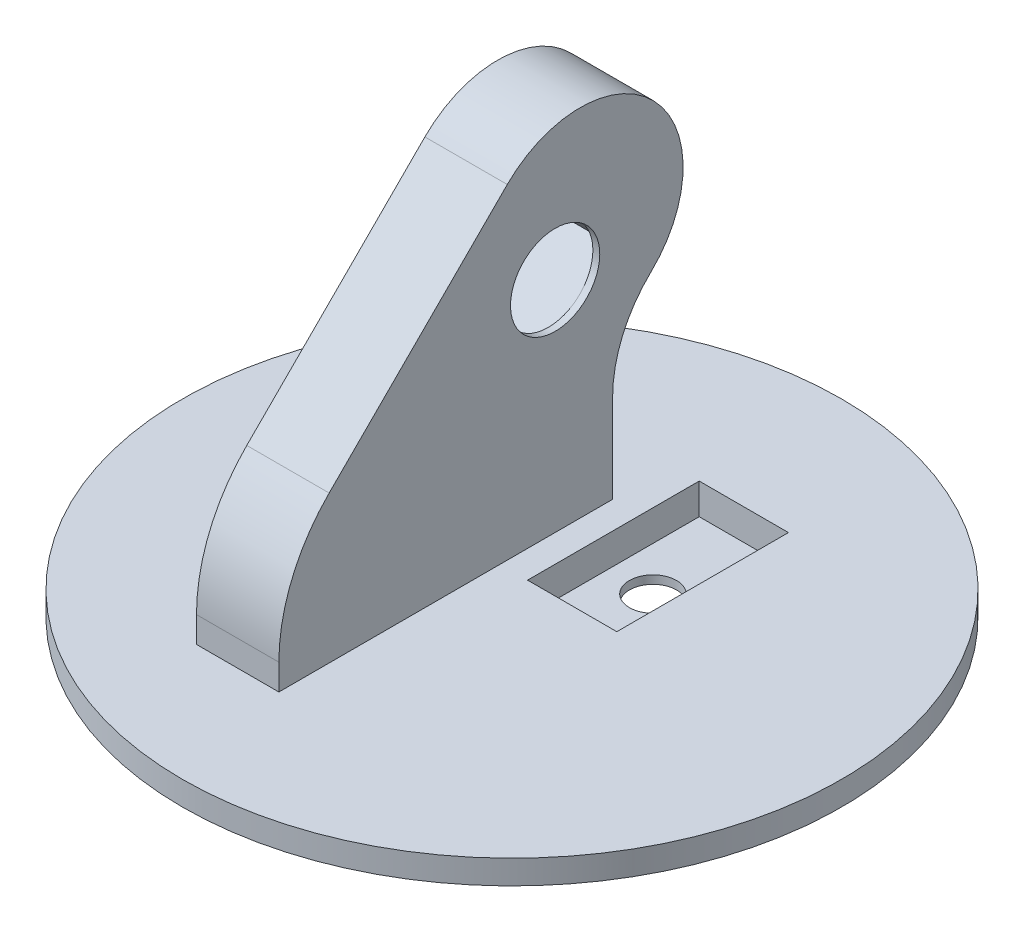
from build123d import *

# Parameters (mm, degrees)
SKETCH2_R           = 48
BOSS_EXTRUDE1_DEPTH = 3.5
BOSS_EXTRUDE2_DEPTH = 12
SKETCH31_R          = 6.5
CUT_EXTRUDE18_DEPTH = 95.612882669
CUT_EXTRUDE19_DEPTH = 11
SKETCH32_R          = 1
CUT_EXTRUDE20_DEPTH = 4.5
SKETCH33_R          = 43.5
BOSS_EXTRUDE3_DEPTH = 2.2
SKETCH34_W          = 13
SKETCH34_H          = 25
CUT_EXTRUDE21_DEPTH = 4.5
SKETCH35_R          = 3.43
CUT_EXTRUDE22_DEPTH = 146.83305399


with BuildPart() as part:
    # Sketch2 → Boss-Extrude1 (new body)
    with BuildSketch(Plane(origin=(0, 0, 0), x_dir=(1, 0, 0), z_dir=(0, 1, 0))):
        Circle(SKETCH2_R)
    extrude(amount=BOSS_EXTRUDE1_DEPTH)

    # Sketch7 → Boss-Extrude2 (add)
    with BuildSketch(Plane(origin=(-4, 0, 0), x_dir=(0, 0, -1), z_dir=(1, 0, 0))):
        with BuildLine():
            Line((18.652115716, 3.5), (18.652115716, 16.356133126))
            ThreePointArc((18.652115716, 16.356133126), (20.111216245, 23.455333411), (24.251965127, 29.403595153))
            ThreePointArc((24.251965127, 29.403595153), (24.659117989, 50.747356958), (3.311904584, 50.883081894))
            Line((3.311904584, 50.883081894), (-22.631121669, 24.94005564))
            ThreePointArc((-22.631121669, 24.94005564), (-28.050440452, 16.82947192), (-29.95345214, 7.262386111))
            Line((-29.95345214, 7.262386111), (-29.95345214, 3.5))
            Line((-29.95345214, 3.5), (18.652115716, 3.5))
        make_face()
    extrude(amount=-BOSS_EXTRUDE2_DEPTH)

    # Sketch31 → Cut-Extrude18 (cut, through all)
    with BuildSketch(Plane(origin=(-16, 10.461755651, -5.359516796), x_dir=(0, 0, 1), z_dir=(-1, 0, 0))):
        with Locations((-4.922469695, 24.905412087)):
            Circle(SKETCH31_R)
    extrude(amount=-CUT_EXTRUDE18_DEPTH, mode=Mode.SUBTRACT)

    # Sketch31<3> → Cut-Extrude19 (cut)
    with BuildSketch(Plane(origin=(-16, 10.461755651, -5.359516796), x_dir=(0, 0, 1), z_dir=(-1, 0, 0))):
        Polygon((-5.41546104, 34.054639751), (11.74960782, 18.74580534), (3.09678837, 9.043809897), (-14.06828049, 24.352644308), align=None)
    extrude(amount=-CUT_EXTRUDE19_DEPTH, mode=Mode.SUBTRACT)

    # Sketch32 → Cut-Extrude20 (cut)
    with BuildSketch(Plane.ZY.offset(16)):
        with Locations((-17.080620038, 41.264504586)):
            Circle(SKETCH32_R)
        with Locations((3.929449654, 22.692559529)):
            Circle(SKETCH32_R)
    extrude(amount=-CUT_EXTRUDE20_DEPTH, mode=Mode.SUBTRACT)

    # Sketch33 → Boss-Extrude3 (add)
    with BuildSketch(Plane.XZ):
        Circle(SKETCH33_R)
    extrude(amount=BOSS_EXTRUDE3_DEPTH)

    # Sketch34 → Cut-Extrude21 (cut)
    with BuildSketch(Plane(origin=(0, 3.5, 0), x_dir=(1, 0, 0), z_dir=(0, 1, 0))):
        with Locations((6.5, 14.76673659)):
            Rectangle(SKETCH34_W, SKETCH34_H)
    extrude(amount=-CUT_EXTRUDE21_DEPTH, mode=Mode.SUBTRACT)

    # Sketch35 → Cut-Extrude22 (cut, through all)
    with BuildSketch(Plane(origin=(70.696833098, 3.5, -19.063682787), x_dir=(1, 0, 0), z_dir=(0, 1, 0))):
        with Locations((-64.309508134, -4.916757219)):
            Circle(SKETCH35_R)
    extrude(amount=-CUT_EXTRUDE22_DEPTH, mode=Mode.SUBTRACT)


solid = part.part
